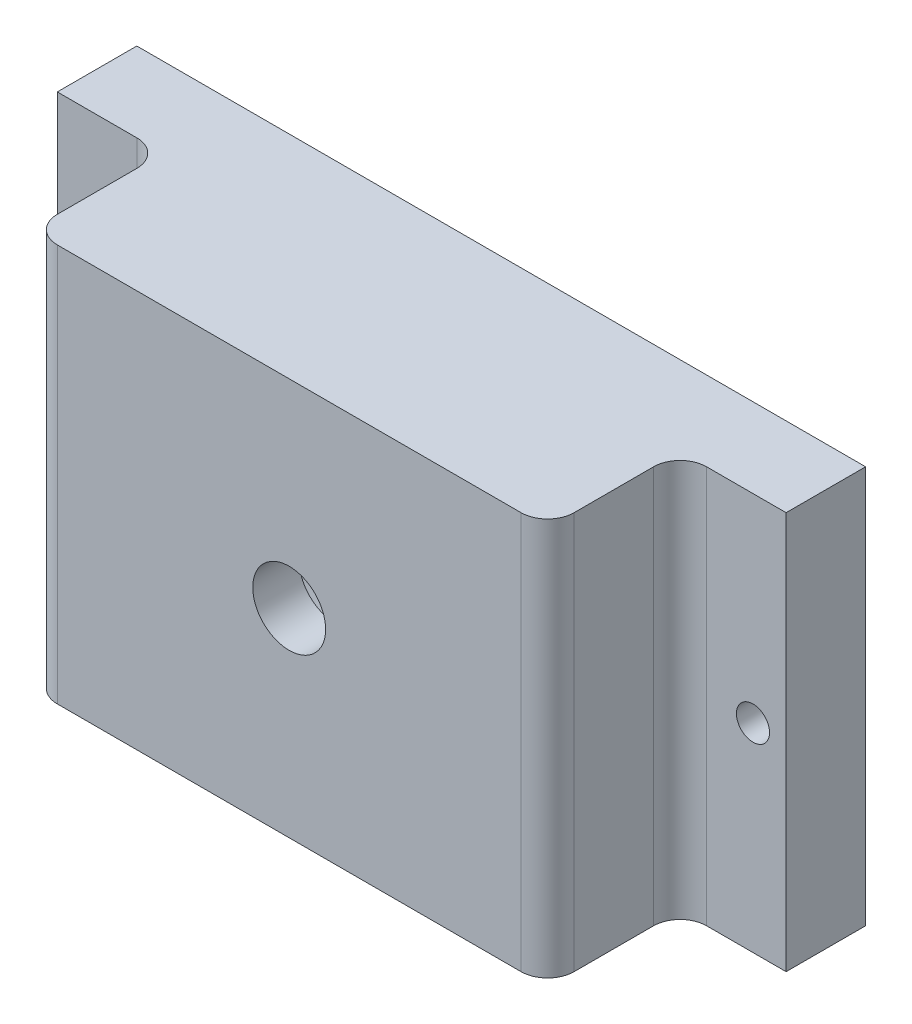
from build123d import *

# Parameters (mm, degrees)
SKETCH1_W          = 55
SKETCH1_H          = 30
SKETCH1_R          = 1.25
MAIN_DEPTH         = 16
SKETCH2_R          = 10.3
CENTRALHOLE_DEPTH  = 12.5
SKETCH5_R          = 2.75
SKETCH5_W          = 8
SKETCH5_H          = 30
CUT_EXTRUDE3_DEPTH = 10
FILLET1_R          = 2


with BuildPart() as part:
    # Sketch1 → Main (new body)
    with BuildSketch(Plane.XY):
        Rectangle(SKETCH1_W, SKETCH1_H)
        with Locations((-25, 0)):
            Circle(SKETCH1_R, mode=Mode.SUBTRACT)
        with Locations((25, 0)):
            Circle(SKETCH1_R, mode=Mode.SUBTRACT)
    extrude(amount=MAIN_DEPTH)

    # Sketch2 → CentralHole (cut)
    with BuildSketch(Plane.XY):
        Circle(SKETCH2_R)
    extrude(amount=CENTRALHOLE_DEPTH, mode=Mode.SUBTRACT)

    # Sketch5 → Cut-Extrude3 (cut)
    with BuildSketch(Plane.XY.offset(16)):
        Circle(SKETCH5_R)
        with Locations((23.5, 0)):
            Rectangle(SKETCH5_W, SKETCH5_H)
        with Locations((-23.5, 0)):
            Rectangle(SKETCH5_W, SKETCH5_H)
    extrude(amount=-CUT_EXTRUDE3_DEPTH, mode=Mode.SUBTRACT)

    # Fillet1
    fillet1_edges = [part.edges().sort_by_distance(p)[0] for p in [
        (-19.5, 0, 16),
        (19.5, 0, 16),
        (-19.5, 0, 6),
        (19.5, 0, 6),
    ]]
    fillet(fillet1_edges, radius=FILLET1_R)


solid = part.part
